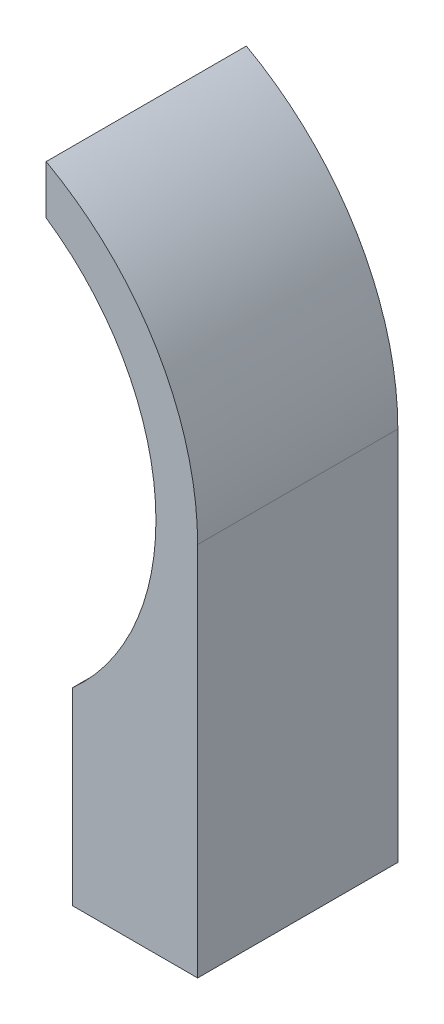
from build123d import *

# Parameters (mm, degrees)
INNER_RING_RIGHT_SIDE_DEPTH = 120


with BuildPart() as part:
    # Sketch2 → Inner Ring - Right Side (new body)
    with BuildSketch(Plane.XY):
        with BuildLine():
            Line((100, -111.803398875), (100, -225))
            Line((100, -225), (175, -225))
            Line((175, -225), (175, 0))
            ThreePointArc((175, 0), (150.598804776, 89.134729483), (84.2, 153.412385419))
            Line((84.2, 153.412385419), (84.2, 124.138471072))
            ThreePointArc((84.2, 124.138471072), (149.664797125, 10.022399988), (100, -111.803398875))
        make_face()
    extrude(amount=INNER_RING_RIGHT_SIDE_DEPTH)


solid = part.part
